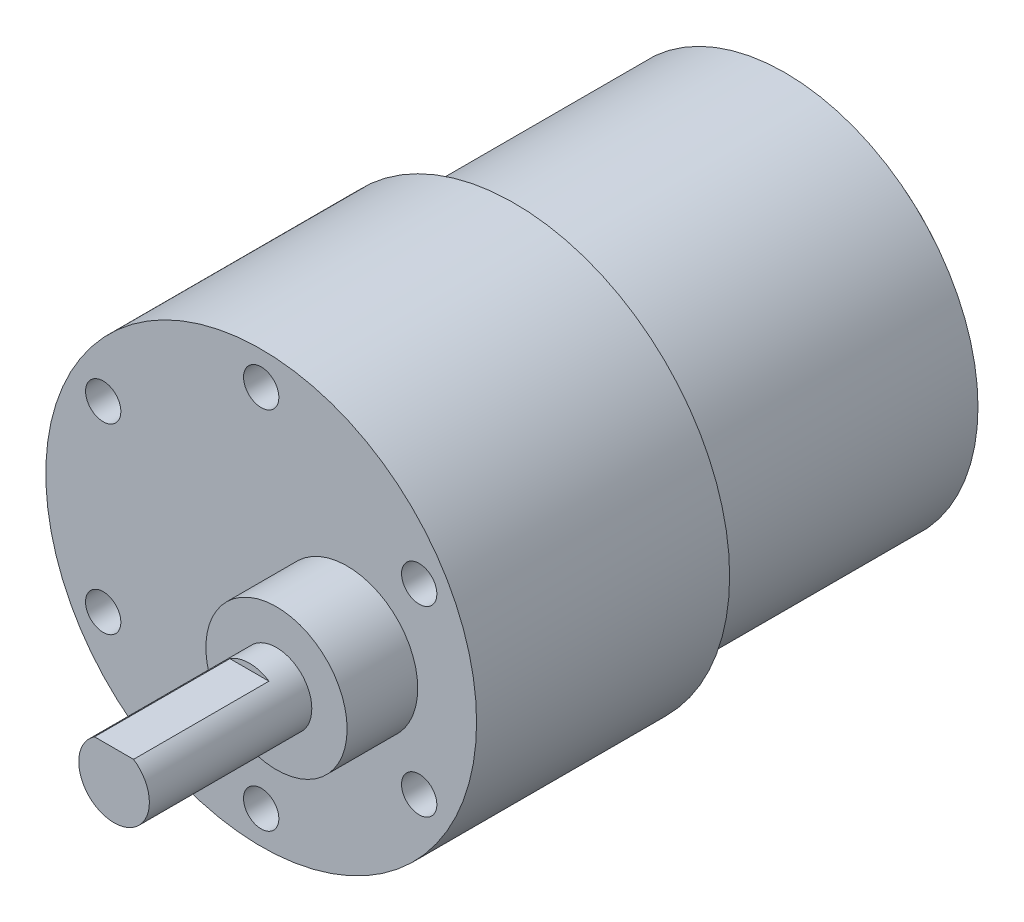
from build123d import *

# Parameters (mm, degrees)
SKETCH_1_R          = 18.3
EXTRUDE_1_DEPTH     = 21.5
SKETCH_2_R          = 1.5
CUT_EXTRUDE_1_DEPTH = 5
SKETCH_3_R          = 6
EXTRUDE_2_DEPTH     = 6
SKETCH_4_R          = 3
EXTRUDE_3_DEPTH     = 13.8
CUT_EXTRUDE_START   = -11.5
CUT_EXTRUDE_2_DEPTH = 11.5
SKETCH_6_R          = 16.4
EXTRUDE_4_DEPTH     = 23
SKETCH_7_R          = 15
EXTRUDE_5_DEPTH     = 1
SKETCH_8_R          = 3
EXTRUDE_6_DEPTH     = 4
SKETCH_9_W          = 12.161670498
SKETCH_9_H          = 4.500444444
EXTRUDE_7_DEPTH     = 7.9
SKETCH_10_W         = 1.2
SKETCH_10_H         = 2.711111112
EXTRUDE_8_DEPTH     = 4
SKETCH_11_W         = 10.179858782
SKETCH_11_H         = 6.369590588
CUT_EXTRUDE_3_DEPTH = 6


with BuildPart() as part:
    # 草图1 → 凸台-拉伸1 (new body)
    with BuildSketch(Plane.XY):
        Circle(SKETCH_1_R)
    extrude(amount=EXTRUDE_1_DEPTH)

    # 草图2 → 切除-拉伸1 (cut)
    with BuildSketch(Plane.XY.offset(21.5)):
        with Locations((0, 15.5)):
            Circle(SKETCH_2_R)
        with Locations((13.423393759, 7.75)):
            Circle(SKETCH_2_R)
        with Locations((13.423393759, -7.75)):
            Circle(SKETCH_2_R)
        with Locations((0, -15.5)):
            Circle(SKETCH_2_R)
        with Locations((-13.423393759, -7.75)):
            Circle(SKETCH_2_R)
        with Locations((-13.423393759, 7.75)):
            Circle(SKETCH_2_R)
    extrude(amount=-CUT_EXTRUDE_1_DEPTH, mode=Mode.SUBTRACT)

    # 草图3 → 凸台-拉伸2 (add)
    with BuildSketch(Plane.XY.offset(21.5)):
        with Locations((7.3, 0)):
            Circle(SKETCH_3_R)
    extrude(amount=EXTRUDE_2_DEPTH)

    # 草图4 → 凸台-拉伸3 (add)
    with BuildSketch(Plane.XY.offset(27.5)):
        with Locations((7.3, 0)):
            Circle(SKETCH_4_R)
    extrude(amount=EXTRUDE_3_DEPTH)

    # 草图5 → 切除-拉伸2 (cut)
    with BuildSketch(Plane.XY.offset(41.3).offset(CUT_EXTRUDE_START)):
        with BuildLine():
            Line((5.641687605, 2.5), (8.958312395, 2.5))
            ThreePointArc((8.958312395, 2.5), (7.3, 3), (5.641687605, 2.5))
        make_face()
    extrude(amount=CUT_EXTRUDE_2_DEPTH, mode=Mode.SUBTRACT)

    # 草图6 → 凸台-拉伸4 (add)
    with BuildSketch(Plane(origin=(0, 0, 0), x_dir=(-1, 0, 0), z_dir=(0, 0, -1))):
        Circle(SKETCH_6_R)
    extrude(amount=EXTRUDE_4_DEPTH)

    # 草图7 → 凸台-拉伸5 (add)
    with BuildSketch(Plane(origin=(0, 0, -23), x_dir=(-1, 0, 0), z_dir=(0, 0, -1))):
        Circle(SKETCH_7_R)
    extrude(amount=EXTRUDE_5_DEPTH)

    # 草图8 → 凸台-拉伸6 (add)
    with BuildSketch(Plane(origin=(0, 0, -24), x_dir=(-1, 0, 0), z_dir=(0, 0, -1))):
        Circle(SKETCH_8_R)
    extrude(amount=EXTRUDE_6_DEPTH)

    # 草图9 → 凸台-拉伸7 (add)
    with BuildSketch(Plane(origin=(0, 0, -24), x_dir=(-1, 0, 0), z_dir=(0, 0, -1))):
        with Locations((0, -11.791042912)):
            Rectangle(SKETCH_9_W, SKETCH_9_H)
    extrude(amount=EXTRUDE_7_DEPTH)

    # 草图10 → 凸台-拉伸8 (add)
    with BuildSketch(Plane(origin=(0, 0, -24), x_dir=(-1, 0, 0), z_dir=(0, 0, -1))):
        with Locations((-5.289655172, 0)):
            Rectangle(SKETCH_10_W, SKETCH_10_H)
        with Locations((5.835249042, 0)):
            Rectangle(SKETCH_10_W, SKETCH_10_H)
    extrude(amount=EXTRUDE_8_DEPTH)

    # 草图11 → 切除-拉伸3 (cut)
    with BuildSketch(Plane(origin=(0, 0, -31.9), x_dir=(-1, 0, 0), z_dir=(0, 0, -1))):
        with Locations((0, -14.041265134)):
            Rectangle(SKETCH_11_W, SKETCH_11_H)
    extrude(amount=-CUT_EXTRUDE_3_DEPTH, mode=Mode.SUBTRACT)


solid = part.part
